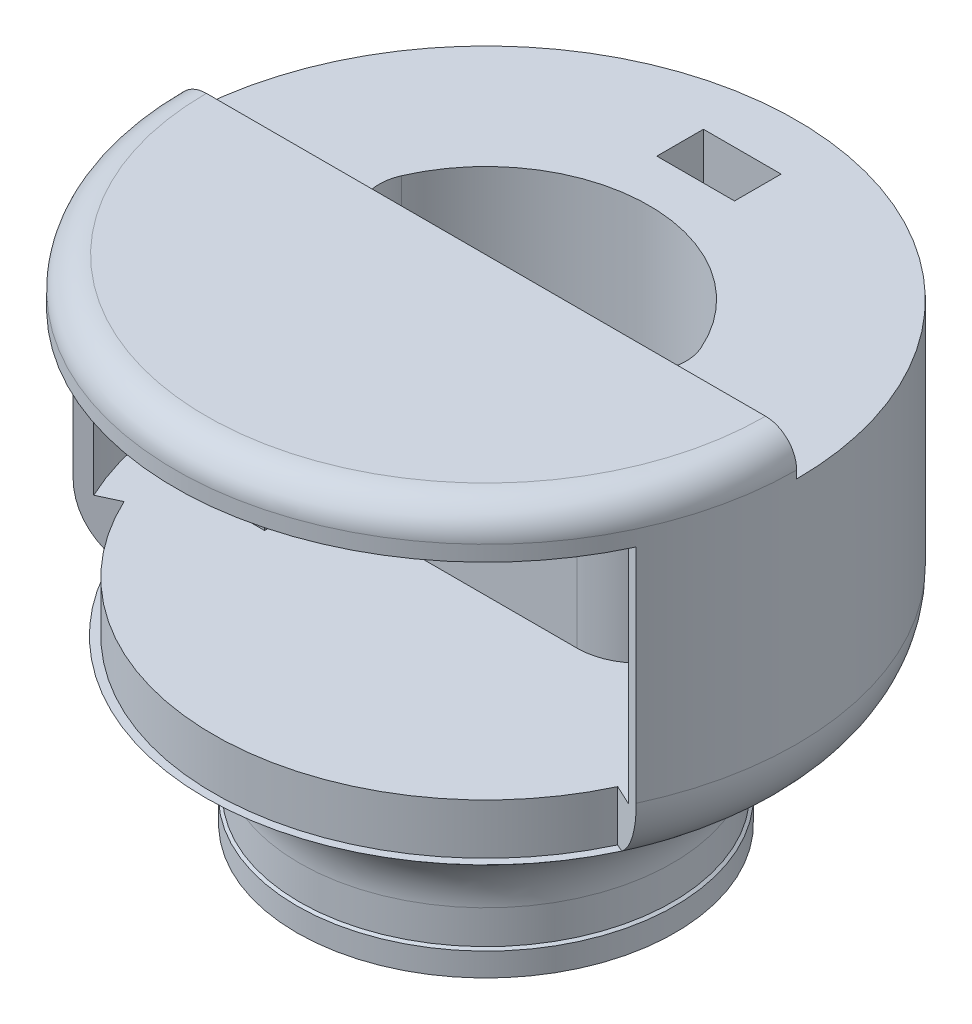
from build123d import *

# Parameters (mm, degrees)
CUT_EXTRUDE3_DEPTH           = 60
SKETCH9_R                    = 38
SKETCH9_R_2                  = 23
CUT_EXTRUDE5_DEPTH           = 30
SKETCH19_W                   = 12
SKETCH19_H                   = 36.5
CUT_REVOLVE2_ANGLE           = 65
CUT_REVOLVE2_OTHER_WAY_ANGLE = 65
SKETCH21_W                   = 3.25
SKETCH21_H                   = 4
BOSS_EXTRUDE3_DEPTH          = 1.35
CIRPATTERN1_COUNT            = 5
CUT_EXTRUDE9_START           = -5
CUT_EXTRUDE9_DEPTH           = 5
SKETCH23_R                   = 10.5
CUT_EXTRUDE10_DEPTH          = 10
SKETCH24_W                   = 15
SKETCH24_H                   = 8
BOSS_EXTRUDE4_DEPTH          = 8
SKETCH26_W                   = 10
SKETCH26_H                   = 6
CUT_EXTRUDE11_DEPTH          = 10
SKETCH27_W                   = 4
SKETCH27_H                   = 5
CUT_EXTRUDE12_DEPTH          = 5
CUT_EXTRUDE14_DEPTH          = 30
SKETCH29_R                   = 1
CUT_EXTRUDE15_DEPTH          = 15
FILLET1_R                    = 6
FILLET2_R                    = 8
SKETCH31_W                   = 7
SKETCH31_H                   = 5
BOSS_EXTRUDE7_DEPTH          = 8


with BuildPart() as part:
    # Sketch1 → Revolve1 (revolve)
    with BuildSketch(Plane.XY):
        with BuildLine():
            Line((0, 63.427876097), (36, 63.427876097))
            ThreePointArc((36, 63.427876097), (38.828427125, 62.256303222), (40, 59.427876097))
            Line((40, 59.427876097), (40, 28.846818009))
            ThreePointArc((40, 28.846818009), (38.792081772, 24.082439968), (35.460140376, 20.469057744))
            Line((35.460140376, 20.469057744), (28.539859624, 15.958818353))
            ThreePointArc((28.539859624, 15.958818353), (25.207918228, 12.345436129), (24, 7.581058088))
            Line((24, 7.581058088), (24, 3.25))
            Line((24, 3.25), (24.35, 3))
            Line((24.35, 3), (24.35, 0))
            Line((24.35, 0), (22.5, 0))
            Line((22.5, 0), (22.5, 12.5))
            ThreePointArc((22.5, 12.5), (22.353553391, 12.853553391), (22, 13))
            Line((22, 13), (0, 13))
            Line((0, 13), (0, 63.427876097))
        make_face()
    revolve(axis=Axis((0, 0, 0), (0, 1, 0)))

    # Sketch11 → Cut-Extrude3 (cut)
    with BuildSketch(Plane(origin=(0, 13, 0), x_dir=(-1, 0, 0), z_dir=(0, -1, 0))):
        with BuildLine():
            Line((-21, 0), (21, 0))
            ThreePointArc((21, 0), (0, 21), (-21, 0))
        make_face()
    extrude(amount=-CUT_EXTRUDE3_DEPTH, mode=Mode.SUBTRACT)

    # Sketch9 → Cut-Extrude5 (cut)
    with BuildSketch(Plane(origin=(0, 57.427876097, 0), x_dir=(1, 0, 0), z_dir=(0, 1, 0))):
        Circle(SKETCH9_R)
        Circle(SKETCH9_R_2, mode=Mode.SUBTRACT)
    extrude(amount=-CUT_EXTRUDE5_DEPTH, mode=Mode.SUBTRACT)

    # Sketch19 → Cut-Revolve2 (revolve, cut)
    with BuildSketch(Plane(origin=(0, 0, 0), x_dir=(0, 0, -1), z_dir=(1, 0, 0))):
        with Locations((-41.064715832, 39.177876097)):
            Rectangle(SKETCH19_W, SKETCH19_H)
    revolve(axis=Axis((0, 0, 0), (0, 1, 0)), revolution_arc=CUT_REVOLVE2_ANGLE, mode=Mode.SUBTRACT)

    # Sketch19 → Cut-Revolve2 other way (revolve, cut)
    with BuildSketch(Plane(origin=(0, 0, 0), x_dir=(0, 0, -1), z_dir=(1, 0, 0))):
        with Locations((-41.064715832, 39.177876097)):
            Rectangle(SKETCH19_W, SKETCH19_H)
    revolve(axis=Axis((0, 0, 0), (0, -1, 0)), revolution_arc=CUT_REVOLVE2_OTHER_WAY_ANGLE, mode=Mode.SUBTRACT)

    # Sketch21 → Boss-Extrude3 (add)
    with BuildSketch(Plane(origin=(0, 0, 22.5), x_dir=(-1, 0, 0), z_dir=(0, 0, -1))):
        with Locations((0, 2)):
            Rectangle(SKETCH21_W, SKETCH21_H)
    boss_extrude3 = extrude(amount=BOSS_EXTRUDE3_DEPTH)

    # CirPattern1: Boss-Extrude3 ×5 about axis
    cirpattern1_axis = Axis((0, 0, 0), (0, -1, 0))
    for i in range(1, CIRPATTERN1_COUNT):
        add(boss_extrude3.rotate(cirpattern1_axis, i * 360 / CIRPATTERN1_COUNT))

    # Sketch22 → Cut-Extrude9 (cut)
    with BuildSketch(Plane(origin=(0, 63.427876097, 0), x_dir=(1, 0, 0), z_dir=(0, 1, 0)).offset(CUT_EXTRUDE9_START)):
        with BuildLine():
            Line((-40, 0), (40, 0))
            ThreePointArc((40, 0), (0, 40), (-40, 0))
        make_face()
    extrude(amount=CUT_EXTRUDE9_DEPTH, mode=Mode.SUBTRACT)

    # Sketch23 → Cut-Extrude10 (cut)
    with BuildSketch(Plane(origin=(0, 0, -40), x_dir=(-1, 0, 0), z_dir=(0, 0, -1))):
        with Locations((0, 44.137876097)):
            Circle(SKETCH23_R)
    extrude(amount=-CUT_EXTRUDE10_DEPTH, mode=Mode.SUBTRACT)

    # Sketch24 → Boss-Extrude4 (add)
    with BuildSketch(Plane(origin=(0, 58.427876097, 0), x_dir=(1, 0, 0), z_dir=(0, 1, 0))):
        with Locations((0, 30)):
            Rectangle(SKETCH24_W, SKETCH24_H)
    extrude(amount=-BOSS_EXTRUDE4_DEPTH)

    # Sketch26 → Cut-Extrude11 (cut)
    with BuildSketch(Plane(origin=(0, 58.427876097, 0), x_dir=(1, 0, 0), z_dir=(0, 1, 0))):
        with Locations((0, 30)):
            Rectangle(SKETCH26_W, SKETCH26_H)
    extrude(amount=-CUT_EXTRUDE11_DEPTH, mode=Mode.SUBTRACT)

    # Sketch27 → Cut-Extrude12 (cut)
    with BuildSketch(Plane(origin=(7.5, 0, 0), x_dir=(0, 0, -1), z_dir=(1, 0, 0))):
        with Locations((30, 53.927876097)):
            Rectangle(SKETCH27_W, SKETCH27_H)
    extrude(amount=-CUT_EXTRUDE12_DEPTH, mode=Mode.SUBTRACT)

    # Sketch28 → Cut-Extrude14 (cut)
    with BuildSketch(Plane(origin=(0, 57.427876097, 0), x_dir=(1, 0, 0), z_dir=(0, 1, 0))):
        with BuildLine():
            Line((-22.912878475, -2), (22.912878475, -2))
            ThreePointArc((22.912878475, -2), (0, -23), (-22.912878475, -2))
        make_face()
    extrude(amount=-CUT_EXTRUDE14_DEPTH, mode=Mode.SUBTRACT)

    # Sketch29 → Cut-Extrude15 (cut)
    with BuildSketch(Plane(origin=(0, 0, 0), x_dir=(-1, 0, 0), z_dir=(0, 0, -1))):
        with Locations((-30.416198487, 60.927876097)):
            Circle(SKETCH29_R)
        with Locations((30.416198487, 60.927876097)):
            Circle(SKETCH29_R)
        with Locations((0, 60.927876097)):
            Circle(SKETCH29_R)
    extrude(amount=-CUT_EXTRUDE15_DEPTH, mode=Mode.SUBTRACT)

    # Fillet1
    fillet1_edges = [part.edges().sort_by_distance(p)[0] for p in [
        (-21, 35.713938048, 0),
        (21, 35.713938048, 0),
    ]]
    fillet(fillet1_edges, radius=FILLET1_R)

    # Fillet2
    fillet2_edges = [part.edges().sort_by_distance(p)[0] for p in [
        (22.912878475, 42.427876097, 2),
        (-22.912878475, 42.427876097, 2),
    ]]
    fillet(fillet2_edges, radius=FILLET2_R)

    # Sketch31 → Boss-Extrude7 (add)
    with BuildSketch(Plane(origin=(0, 58.427876097, 0), x_dir=(1, 0, 0), z_dir=(0, 1, 0))):
        with Locations((0, -29.5)):
            Rectangle(SKETCH31_W, SKETCH31_H)
    extrude(amount=-BOSS_EXTRUDE7_DEPTH)


solid = part.part
